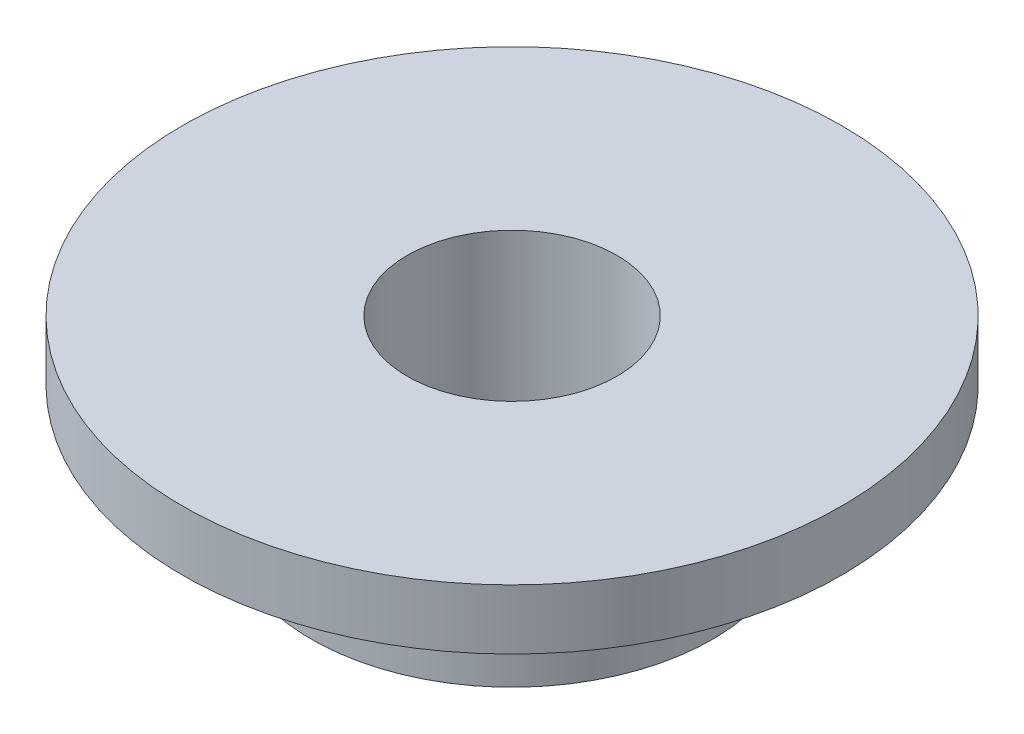
from build123d import *


with BuildPart() as part:
    # Эскиз1 → Повернуть1 (revolve)
    with BuildSketch(Plane.XY):
        Polygon((3.5, 0), (3.5, 6), (11, 6), (11, 4), (6.7, 4), (6.7, 0), align=None)
    revolve(axis=Axis((0, 0, 0), (0, 1, 0)))


solid = part.part
